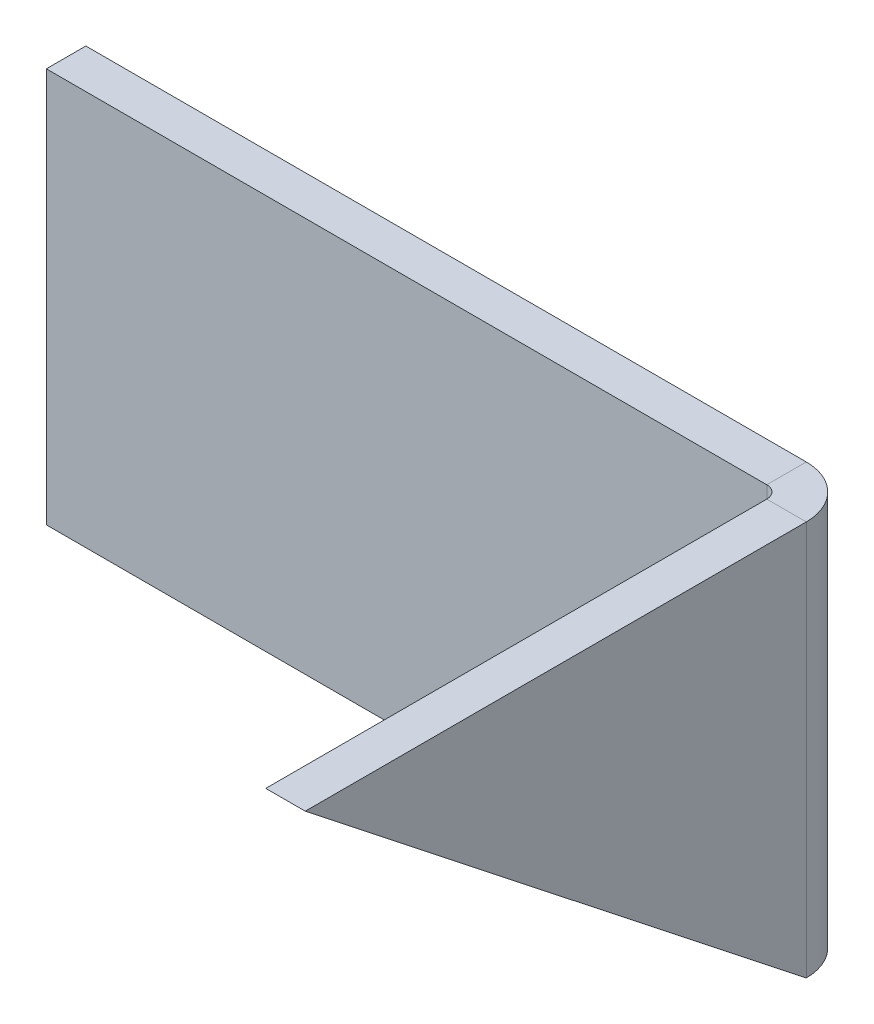
from build123d import *

# Parameters (mm, degrees)
SKETCH2_W               = 57.912
SKETCH2_H               = 31.75
BASE_FLANGE1_DEPTH      = 3.175
EDGE_FLANGE1_DEPTH      = 31.75
CUT_EXTRUDE2_DEPTH      = 78.991112917
CUT_EXTRUDE2_DEPTH_BACK = 3.175


# Sheet-metal steps are written as plain solids
with BuildPart() as part:
    # Sketch2 → Base-Flange1 (new body)
    with BuildSketch(Plane.XY):
        Rectangle(SKETCH2_W, SKETCH2_H)
    extrude(amount=BASE_FLANGE1_DEPTH)

    # Edge-Flange1 section (across the edge) → Edge-Flange1 (add)
    with BuildSketch(Plane(origin=(29.956, -15.875, 3.175), x_dir=(-1, 0, 0), z_dir=(0, 1, 0))):
        with BuildLine():
            Line((-3.175, 1), (-3.175, 41.275))
            Line((-3.175, 41.275), (0, 41.275))
            Line((0, 41.275), (0, 1))
            ThreePointArc((0, 1), (0.292893219, 0.292893219), (1, 0))
            Line((1, 0), (1, -3.175))
            ThreePointArc((1, -3.175), (-1.952170811, -1.952170811), (-3.175, 1))
        make_face()
    extrude(amount=EDGE_FLANGE1_DEPTH)

    # Sketch11 → Cut-Extrude2 (cut, two sides: drawn at the far end of the back side and taken through both)
    with BuildSketch(Plane(origin=(33.131, 0, 0), x_dir=(0, 0, -1), z_dir=(1, 0, 0)).offset(-CUT_EXTRUDE2_DEPTH_BACK)):
        Polygon((89.473958122, -89.701304665), (-4.175, -15.875), (-44.45, 15.875), (-138.098958122, 89.701304665), (-285.751567452, -97.596611579), (-58.178651208, -276.999220909), align=None)
    extrude(amount=CUT_EXTRUDE2_DEPTH + CUT_EXTRUDE2_DEPTH_BACK, mode=Mode.SUBTRACT)


solid = part.part
